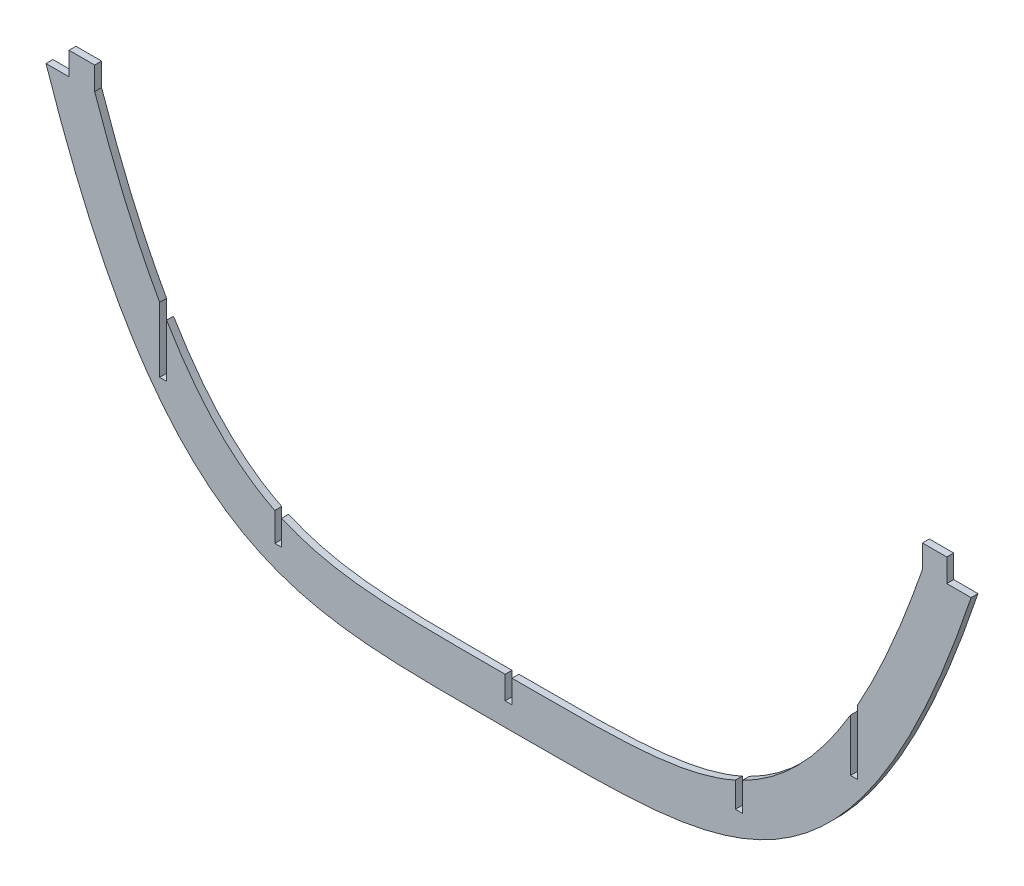
from build123d import *

# Parameters (mm, degrees)
BOSS_EXTRUDE1_DEPTH = 3
SKETCH2_W           = 2.999999902
SKETCH2_H           = 11.368148841
CUT_EXTRUDE2_DEPTH  = 22
SKETCH4_W           = 3
SKETCH4_H           = 12.91245629
CUT_EXTRUDE3_DEPTH  = 45
SKETCH5_W           = 3
SKETCH5_H           = 17.735525731
CUT_EXTRUDE4_DEPTH  = 38
SKETCH6_W           = 3
SKETCH6_H           = 30.838195809
CUT_EXTRUDE5_DEPTH  = 99
CUT_EXTRUDE6_DEPTH  = 239


with BuildPart() as part:
    # Sketch1 → Boss-Extrude1 (new body)
    with BuildSketch(Plane.XY):
        with BuildLine():
            Line((-190.857104702, 159.999999898), (-179.730540998, 159.999999898))
            Line((-179.730540998, 159.999999898), (-179.730540998, 149.999999898))
            add(Edge.make_bspline(
                [(-179.730540998, 149.999999898), (-179.435736296, 149.148237012), (-178.129369144, 145.400432921), (-175.809971547, 138.948879865), (-172.785816947, 130.935113685), (-168.767754042, 120.798312384), (-163.776796782, 109.130589616), (-157.84743559, 96.632896422), (-151.989239921, 85.541409366), (-144.28873539, 72.497307507), (-134.900677689, 59.219307637), (-124.086780391, 47.32628366), (-113.70604162, 38.644244548), (-103.594321478, 32.38075232), (-93.477134717, 27.890378411), (-83.091397363, 24.726267775), (-68.68501467, 21.878302713), (-49.516353483, 20.30417739), (-25.106590618, 19.975287666), (-2.7e-08, 20.012356167), (25.106590565, 19.975287666), (49.516353432, 20.304177388), (68.685014622, 21.878302707), (83.091397317, 24.726267763), (93.477134673, 27.890378394), (103.594321435, 32.380752297), (113.706041576, 38.644244516), (124.086780346, 47.326283616), (134.900677642, 59.219307577), (144.288735341, 72.497307432), (151.989239871, 85.541409276), (157.847435539, 96.632896321), (163.776796731, 109.130589502), (168.76775399, 120.798312259), (172.785816895, 130.93511355), (175.809971495, 138.948879723), (178.1293691, 145.400432798), (179.435736262, 149.148236912), (179.730540973, 149.999999823)],
                knots=[0.041921013, 0.041921013, 0.041921013, 0.041921013, 0.044025323, 0.051263016, 0.05850071, 0.065738403, 0.080213789, 0.094689176, 0.109164563, 0.123639949, 0.152590722, 0.181541495, 0.210492269, 0.239443042, 0.268393815, 0.297344588, 0.326295361, 0.384196907, 0.442098454, 0.5, 0.557901546, 0.615803092, 0.673704639, 0.702655412, 0.731606185, 0.760556958, 0.789507731, 0.818458504, 0.847409278, 0.876360051, 0.890835437, 0.905310824, 0.91978621, 0.934261597, 0.94149929, 0.948736984, 0.955974677, 0.958078987, 0.958078987, 0.958078987, 0.958078987], degree=3))
            Line((179.730540973, 149.999999823), (179.730540973, 159.999999823))
            Line((179.730540973, 159.999999823), (190.29382281, 159.999999823))
            Line((190.29382281, 159.999999823), (190.29382281, 149.999999737))
            Line((190.29382281, 149.999999737), (200.857104648, 149.999999737))
            add(Edge.make_bspline(
                [(-200.857104702, 149.999999898), (-100.428552364, -149.999999855), (-2.7e-08, 149.999999814), (100.42855231, -149.999999774), (200.857104648, 149.999999737)],
                knots=[0.03678763, 0.03678763, 0.03678763, 0.03678763, 0.03678763, 0.96321237, 0.96321237, 0.96321237, 0.96321237, 0.96321237], degree=4))
            Line((-200.857104702, 149.999999898), (-190.857104702, 149.999999898))
            Line((-190.857104702, 149.999999898), (-190.857104702, 159.999999898))
        make_face()
    extrude(amount=BOSS_EXTRUDE1_DEPTH)

    # Sketch2 → Cut-Extrude2 (cut)
    with BuildSketch(Plane.XY):
        with Locations((-4.4e-08, 15.684087839)):
            Rectangle(SKETCH2_W, SKETCH2_H)
    extrude(amount=CUT_EXTRUDE2_DEPTH, mode=Mode.SUBTRACT)

    # Sketch4 → Cut-Extrude3 (cut)
    with BuildSketch(Plane.XY):
        with Locations((99.999999956, 25.672228128)):
            Rectangle(SKETCH4_W, SKETCH4_H)
    extrude(amount=CUT_EXTRUDE3_DEPTH, mode=Mode.SUBTRACT)

    # Sketch5 → Cut-Extrude4 (cut)
    with BuildSketch(Plane.XY):
        with Locations((-100, 28.083762866)):
            Rectangle(SKETCH5_W, SKETCH5_H)
    extrude(amount=CUT_EXTRUDE4_DEPTH, mode=Mode.SUBTRACT)

    # Sketch6 → Cut-Extrude5 (cut)
    with BuildSketch(Plane.XY):
        with Locations((-150, 72.075097905)):
            Rectangle(SKETCH6_W, SKETCH6_H)
    extrude(amount=CUT_EXTRUDE5_DEPTH, mode=Mode.SUBTRACT)

    # Sketch7 → Cut-Extrude6 (cut)
    with BuildSketch(Plane.XY):
        Polygon((148.499999956, 59.949736331), (148.499999956, 86.674548715), (151.499999956, 86.674548715), (151.499999956, 59.949736331), (151.499999956, 56.949736331), (148.499999956, 56.949736331), align=None)
    extrude(amount=CUT_EXTRUDE6_DEPTH, mode=Mode.SUBTRACT)


solid = part.part
